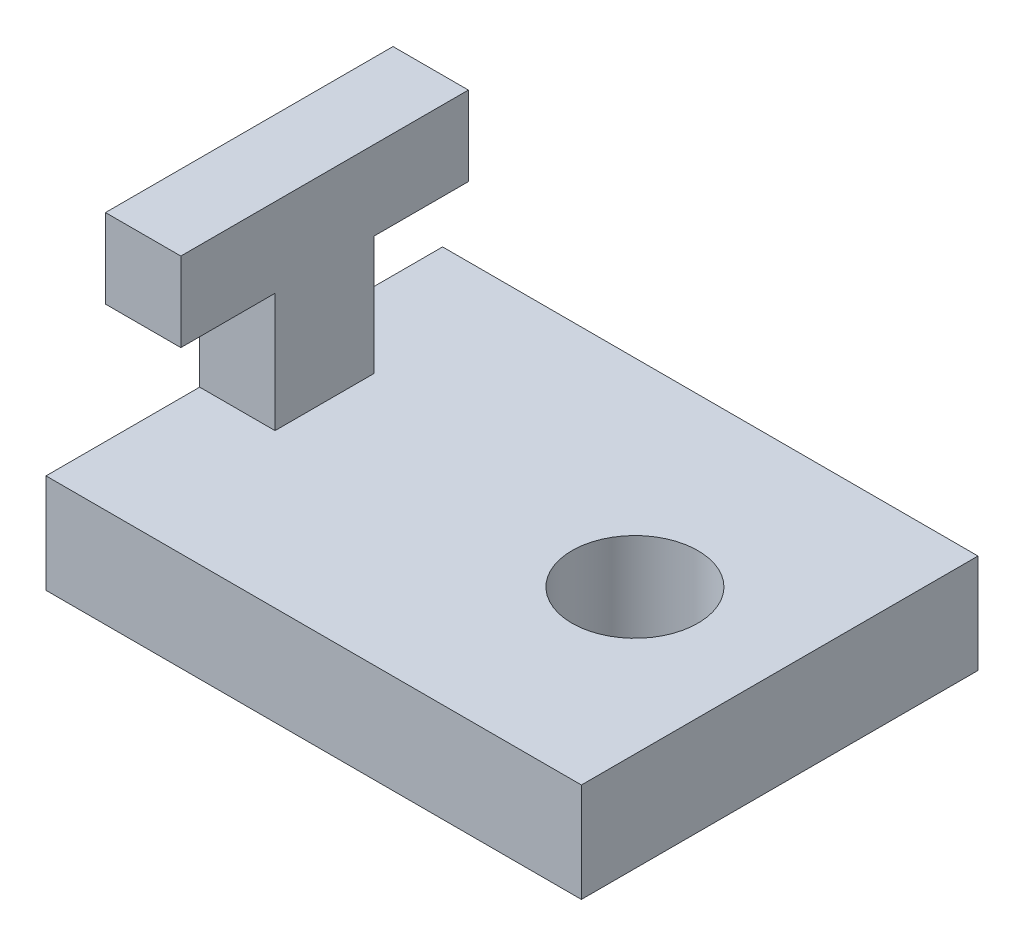
from build123d import *

# Parameters (mm, degrees)
SKETCH1_W           = 685.8
SKETCH1_H           = 508
BOSS_EXTRUDE1_DEPTH = 127
SKETCH2_W           = 96.52
SKETCH2_H           = 127
BOSS_EXTRUDE2_DEPTH = 254
SKETCH3_W           = 96.52
SKETCH3_H           = 101.6
BOSS_EXTRUDE3_DEPTH = 120.65
SKETCH4_W           = 96.52
SKETCH4_H           = 101.6
BOSS_EXTRUDE4_DEPTH = 120.65
HOLE4_OUTLINE_R     = 80.645
HOLE4_DEPTH         = 127


# Read off the part's stored shape, not the designer's step: Hole4
with BuildPart() as part:
    # Sketch1 → Boss-Extrude1 (new body)
    with BuildSketch(Plane(origin=(0, 0, 0), x_dir=(1, 0, 0), z_dir=(0, 1, 0))):
        with Locations((342.9, 254)):
            Rectangle(SKETCH1_W, SKETCH1_H)
    extrude(amount=BOSS_EXTRUDE1_DEPTH)

    # Sketch2 → Boss-Extrude2 (add)
    with BuildSketch(Plane(origin=(0, 127, 0), x_dir=(1, 0, 0), z_dir=(0, 1, 0))):
        with Locations((48.26, 260.35)):
            Rectangle(SKETCH2_W, SKETCH2_H)
    extrude(amount=BOSS_EXTRUDE2_DEPTH)

    # Sketch3 → Boss-Extrude3 (add)
    with BuildSketch(Plane.XY.offset(-196.85)):
        with Locations((48.26, 330.2)):
            Rectangle(SKETCH3_W, SKETCH3_H)
    extrude(amount=BOSS_EXTRUDE3_DEPTH)

    # Sketch4 → Boss-Extrude4 (add)
    with BuildSketch(Plane(origin=(0, 0, -323.85), x_dir=(-1, 0, 0), z_dir=(0, 0, -1))):
        with Locations((-48.26, 330.2)):
            Rectangle(SKETCH4_W, SKETCH4_H)
    extrude(amount=BOSS_EXTRUDE4_DEPTH)

    # Hole4 outline → Hole4 (cut)
    with BuildSketch(Plane(origin=(0, 0, 0), x_dir=(1, 0, 0), z_dir=(0, 1, 0))):
        with Locations((500.38, 254)):
            Circle(HOLE4_OUTLINE_R)
    extrude(amount=HOLE4_DEPTH, mode=Mode.SUBTRACT)


solid = part.part
